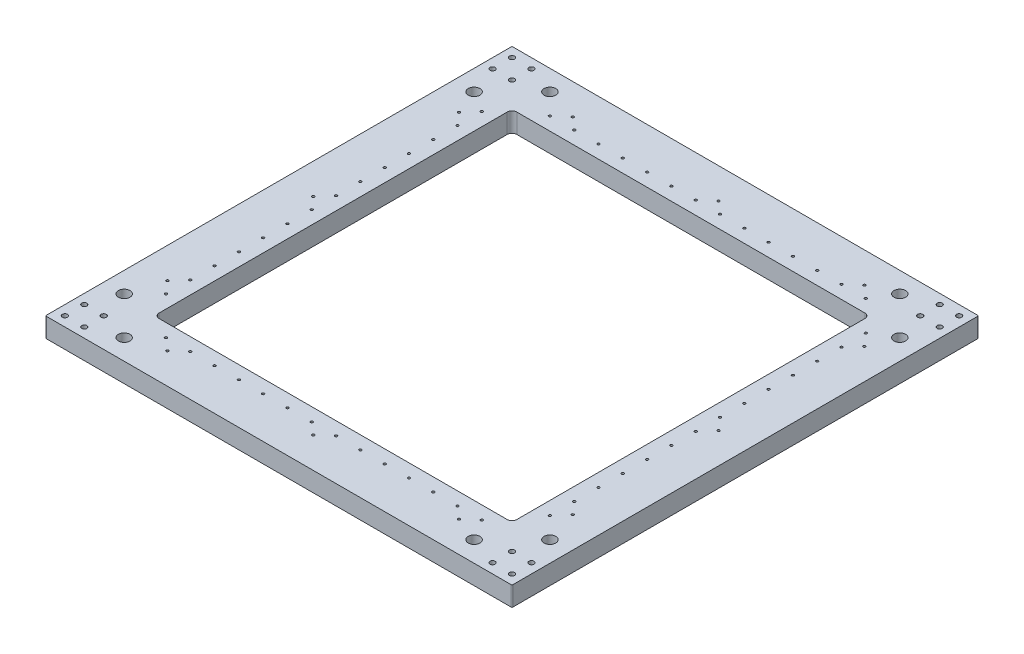
from build123d import *

# Parameters (mm, degrees)
SKETCH1_W                   = 480
SKETCH1_H                   = 480
BOSS_EXTRUDE1_DEPTH         = 20
M5_CLEARANCE_HOLE1_D        = 5.3
BEARING_PRESS_FIT_D         = 12
CIRPATTERN1_COUNT           = 4
SKETCH5_W                   = 368
SKETCH5_H                   = 368
CUT_EXTRUDE1_DEPTH          = 20
SKETCH10_W                  = 408
SKETCH10_H                  = 408
SKETCH10_W_2                = 383
SKETCH10_H_2                = 383
LINEAR_RAIL_SLOT_DEPTH      = 2.5
FILLET2_R                   = 5
FILLET1_R                   = 1
TAP_DRILL_FOR_M3X0_5_TAP1_D = 2.5
CUT_EXTRUDE2_DEPTH          = 3.5
TAP_DRILL_FOR_M3X0_5_TAP2_D = 2.5
FILLET3_R                   = 3
MIRROR7_COPY_1_D            = 2.5
MIRROR7_COPY_2_DEPTH        = 3.5
MIRROR7_COPY_3_D            = 2.5
MIRROR7_COPY_4_D            = 2.5
MIRROR7_COPY_5_DEPTH        = 3.5
MIRROR7_COPY_6_D            = 2.5


with BuildPart() as part:
    # Sketch1 → Boss-Extrude1 (new body)
    with BuildSketch(Plane(origin=(0, 0, 0), x_dir=(1, 0, 0), z_dir=(0, 1, 0))):
        Rectangle(SKETCH1_W, SKETCH1_H)
    extrude(amount=BOSS_EXTRUDE1_DEPTH)

    # M5 Clearance Hole1 (through all)
    with Locations(Plane(origin=(0, 20, 0), x_dir=(1, 0, 0), z_dir=(0, 1, 0))):
        with Locations((-230, 230), (-210, 210), (-210, 230), (-230, 210)):
            m5_clearance_hole1 = Hole(M5_CLEARANCE_HOLE1_D / 2)

    # Bearing Press Fit (through all)
    with Locations(Plane(origin=(0, 20, 0), x_dir=(1, 0, 0), z_dir=(0, 1, 0))):
        with Locations((-180, 219), (-219, 180)):
            bearing_press_fit = Hole(BEARING_PRESS_FIT_D / 2)

    # CirPattern1: M5 Clearance Hole1, Bearing Press Fit ×4 about axis
    cirpattern1_axis = Axis((0, 0, 0), (0, 1, 0))
    add([m5_clearance_hole1.rotate(cirpattern1_axis, i * 360 / CIRPATTERN1_COUNT) for i in range(1, CIRPATTERN1_COUNT)], mode=Mode.SUBTRACT)
    add([bearing_press_fit.rotate(cirpattern1_axis, i * 360 / CIRPATTERN1_COUNT) for i in range(1, CIRPATTERN1_COUNT)], mode=Mode.SUBTRACT)

    # Sketch5 → Cut-Extrude1 (cut)
    with BuildSketch(Plane(origin=(0, 20, 0), x_dir=(1, 0, 0), z_dir=(0, 1, 0))):
        Rectangle(SKETCH5_W, SKETCH5_H)
    extrude(amount=-CUT_EXTRUDE1_DEPTH, mode=Mode.SUBTRACT)

    # Sketch10 → Linear Rail Slot (cut)
    with BuildSketch(Plane(origin=(0, 0, 0), x_dir=(1, 0, 0), z_dir=(0, 1, 0))):
        Rectangle(SKETCH10_W, SKETCH10_H)
        Rectangle(SKETCH10_W_2, SKETCH10_H_2, mode=Mode.SUBTRACT)
    extrude(amount=LINEAR_RAIL_SLOT_DEPTH, mode=Mode.SUBTRACT)

    # Fillet2
    fillet2_edges = [part.edges().sort_by_distance(p)[0] for p in [
        (-184, 10, 184),
        (-184, 10, -184),
        (184, 10, -184),
        (184, 10, 184),
    ]]
    fillet(fillet2_edges, radius=FILLET2_R)

    # Fillet1
    fillet1_edges = [part.edges().sort_by_distance(p)[0] for p in [
        (-240, 10, -240),
        (240, 10, -240),
        (240, 10, 240),
        (-240, 10, 240),
    ]]
    fillet(fillet1_edges, radius=FILLET1_R)

    # Tap Drill for M3x0.5 Tap1 (through all)
    with Locations(Plane(origin=(0, 2.5, 0), x_dir=(-1, 0, 0), z_dir=(0, -1, 0))):
        with Locations((-166.5, -197.5), (-141.5, -197.5), (-116.5, -197.5), (-91.5, -197.5), (-66.5, -197.5), (-41.5, -197.5), (-16.5, -197.5), (8.5, -197.5), (33.5, -197.5), (58.5, -197.5), (83.5, -197.5), (108.5, -197.5), (133.5, -197.5), (158.5, -197.5)):
            tap_drill_for_m3x0_5_tap1 = Hole(TAP_DRILL_FOR_M3X0_5_TAP1_D / 2)

    # Sketch14 → Cut-Extrude2 (cut)
    with BuildSketch(Plane.XZ):
        with BuildLine():
            Line((-133.5, 203.5), (-158.5, 203.5))
            ThreePointArc((-158.5, 203.5), (-160.621320344, 204.378679656), (-161.5, 206.5))
            Line((-161.5, 206.5), (-161.5, 210.5))
            ThreePointArc((-161.5, 210.5), (-160.621320344, 212.621320344), (-158.5, 213.5))
            Line((-158.5, 213.5), (-133.5, 213.5))
            ThreePointArc((-133.5, 213.5), (-131.378679656, 212.621320344), (-130.5, 210.5))
            Line((-130.5, 210.5), (-130.5, 206.5))
            ThreePointArc((-130.5, 206.5), (-131.378679656, 204.378679656), (-133.5, 203.5))
        make_face()
        with BuildLine():
            Line((16.5, 203.5), (-8.5, 203.5))
            ThreePointArc((-8.5, 203.5), (-10.621320344, 204.378679656), (-11.5, 206.5))
            Line((-11.5, 206.5), (-11.5, 210.5))
            ThreePointArc((-11.5, 210.5), (-10.621320344, 212.621320344), (-8.5, 213.5))
            Line((-8.5, 213.5), (16.5, 213.5))
            ThreePointArc((16.5, 213.5), (18.621320344, 212.621320344), (19.5, 210.5))
            Line((19.5, 210.5), (19.5, 206.5))
            ThreePointArc((19.5, 206.5), (18.621320344, 204.378679656), (16.5, 203.5))
        make_face()
        with BuildLine():
            Line((166.5, 203.5), (141.5, 203.5))
            ThreePointArc((141.5, 203.5), (139.378679656, 204.378679656), (138.5, 206.5))
            Line((138.5, 206.5), (138.5, 210.5))
            ThreePointArc((138.5, 210.5), (139.378679656, 212.621320344), (141.5, 213.5))
            Line((141.5, 213.5), (166.5, 213.5))
            ThreePointArc((166.5, 213.5), (168.621320344, 212.621320344), (169.5, 210.5))
            Line((169.5, 210.5), (169.5, 206.5))
            ThreePointArc((169.5, 206.5), (168.621320344, 204.378679656), (166.5, 203.5))
        make_face()
    cut_extrude2 = extrude(amount=-CUT_EXTRUDE2_DEPTH, mode=Mode.SUBTRACT)

    # Tap Drill for M3x0.5 Tap2 (through all)
    with Locations(Plane(origin=(0, 3.5, 0), x_dir=(-1, 0, 0), z_dir=(0, -1, 0))):
        with Locations((-154, -208.5), (-4, -208.5), (146, -208.5)):
            tap_drill_for_m3x0_5_tap2 = Hole(TAP_DRILL_FOR_M3X0_5_TAP2_D / 2)

    # Fillet3
    # the kernel refuses this fillet: 3 mm, written as the material it takes off along each edge
    with BuildSketch(Plane(origin=(168.158312395, 2.5, 204), x_dir=(1, 0, 0), z_dir=(0, -1, 0)), Plane(origin=(18.158312395, 2.5, 204), x_dir=(1, 0, 0), z_dir=(0, -1, 0)), Plane(origin=(-131.841687605, 2.5, 204), x_dir=(1, 0, 0), z_dir=(0, -1, 0))) as fillet3_piece_1:
        with BuildLine():
            CenterArc((4.341687605, 3), FILLET3_R, 180, 90)
            Line((1.341687605, 3), (1.041687605, 3))
            ThreePointArc((1.041687605, 3), (1.041687605, 2.5), (-0.16583124, 0.25))
            Line((-0.16583124, 0.25), (0, -0.3))
            Line((0, -0.3), (4.341687605, -0.3))
            Line((4.341687605, -0.3), (4.341687605, 0))
        make_face()
    extrude(amount=13.354219012, mode=Mode.SUBTRACT)
    with BuildSketch(Plane(origin=(139.841687605, 2.5, 204), x_dir=(-0.40826016232850865, 0, 0.9128656198233669), z_dir=(0, -1, 0)), Plane(origin=(-10.158312395, 2.5, 204), x_dir=(-0.4082601623285113, 0, 0.9128656198233657), z_dir=(0, -1, 0)), Plane(origin=(-160.158312395, 2.5, 204), x_dir=(-0.40826016232850865, 0, 0.9128656198233669), z_dir=(0, -1, 0))) as fillet3_piece_2:
        with BuildLine():
            CenterArc((4.511134946, 2.738596859), FILLET3_R, 155.904412315, 90)
            Line((1.772538086, 3.963377346), (1.4986784, 4.085855395))
            Line((1.4986784, 4.085855395), (-0.273859686, 0.122478049))
            Line((-0.273859686, 0.122478049), (0.160514116, -0.253446678))
            ThreePointArc((0.160514116, -0.253446678), (2.7074436, -0.069729605), (3.16387641, -0.273859686))
            Line((3.16387641, -0.273859686), (3.286354459, 0))
        make_face()
    extrude(amount=13.354219012, mode=Mode.SUBTRACT)

    # Mirror3: Tap Drill for M3x0.5 Tap1, Cut-Extrude2, Tap Drill for M3x0.5 Tap2 across plane
    add(tap_drill_for_m3x0_5_tap1.mirror(Plane(origin=(0, 0, 0), x_dir=(-0.7071067811865478, 0, 0.7071067811865472), z_dir=(0.7071067811865475, 0, 0.7071067811865477))), mode=Mode.SUBTRACT)
    add(cut_extrude2.mirror(Plane(origin=(0, 0, 0), x_dir=(-0.7071067811865478, 0, 0.7071067811865472), z_dir=(0.7071067811865475, 0, 0.7071067811865477))), mode=Mode.SUBTRACT)
    add(tap_drill_for_m3x0_5_tap2.mirror(Plane(origin=(0, 0, 0), x_dir=(-0.7071067811865478, 0, 0.7071067811865472), z_dir=(0.7071067811865475, 0, 0.7071067811865477))), mode=Mode.SUBTRACT)

    # Mirror5: Tap Drill for M3x0.5 Tap1, Cut-Extrude2, Tap Drill for M3x0.5 Tap2 across plane
    add(tap_drill_for_m3x0_5_tap1.mirror(Plane.XY), mode=Mode.SUBTRACT)
    add(cut_extrude2.mirror(Plane.XY), mode=Mode.SUBTRACT)
    add(tap_drill_for_m3x0_5_tap2.mirror(Plane.XY), mode=Mode.SUBTRACT)

    # Mirror7 copy 1 (through all)
    with Locations(Plane(origin=(0, 2.5, 0), x_dir=(0, 0, 1), z_dir=(0, -1, 0))):
        with Locations((-166.5, -197.5), (-141.5, -197.5), (-116.5, -197.5), (-91.5, -197.5), (-66.5, -197.5), (-41.5, -197.5), (-16.5, -197.5), (8.5, -197.5), (33.5, -197.5), (58.5, -197.5), (83.5, -197.5), (108.5, -197.5), (133.5, -197.5), (158.5, -197.5)):
            Hole(MIRROR7_COPY_1_D / 2)

    # Mirror7 copy 2 sketch → Mirror7 copy 2 (cut)
    with BuildSketch(Plane(origin=(0, 0, 0), x_dir=(0, 0, -1), z_dir=(0, -1, 0))):
        with BuildLine():
            Line((-133.5, 203.5), (-158.5, 203.5))
            ThreePointArc((-158.5, 203.5), (-160.621320344, 204.378679656), (-161.5, 206.5))
            Line((-161.5, 206.5), (-161.5, 210.5))
            ThreePointArc((-161.5, 210.5), (-160.621320344, 212.621320344), (-158.5, 213.5))
            Line((-158.5, 213.5), (-133.5, 213.5))
            ThreePointArc((-133.5, 213.5), (-131.378679656, 212.621320344), (-130.5, 210.5))
            Line((-130.5, 210.5), (-130.5, 206.5))
            ThreePointArc((-130.5, 206.5), (-131.378679656, 204.378679656), (-133.5, 203.5))
        make_face()
        with BuildLine():
            Line((16.5, 203.5), (-8.5, 203.5))
            ThreePointArc((-8.5, 203.5), (-10.621320344, 204.378679656), (-11.5, 206.5))
            Line((-11.5, 206.5), (-11.5, 210.5))
            ThreePointArc((-11.5, 210.5), (-10.621320344, 212.621320344), (-8.5, 213.5))
            Line((-8.5, 213.5), (16.5, 213.5))
            ThreePointArc((16.5, 213.5), (18.621320344, 212.621320344), (19.5, 210.5))
            Line((19.5, 210.5), (19.5, 206.5))
            ThreePointArc((19.5, 206.5), (18.621320344, 204.378679656), (16.5, 203.5))
        make_face()
        with BuildLine():
            Line((166.5, 203.5), (141.5, 203.5))
            ThreePointArc((141.5, 203.5), (139.378679656, 204.378679656), (138.5, 206.5))
            Line((138.5, 206.5), (138.5, 210.5))
            ThreePointArc((138.5, 210.5), (139.378679656, 212.621320344), (141.5, 213.5))
            Line((141.5, 213.5), (166.5, 213.5))
            ThreePointArc((166.5, 213.5), (168.621320344, 212.621320344), (169.5, 210.5))
            Line((169.5, 210.5), (169.5, 206.5))
            ThreePointArc((169.5, 206.5), (168.621320344, 204.378679656), (166.5, 203.5))
        make_face()
    extrude(amount=-MIRROR7_COPY_2_DEPTH, mode=Mode.SUBTRACT)

    # Mirror7 copy 3 (through all)
    with Locations(Plane(origin=(0, 3.5, 0), x_dir=(0, 0, 1), z_dir=(0, -1, 0))):
        with Locations((-154, -208.5), (-4, -208.5), (146, -208.5)):
            Hole(MIRROR7_COPY_3_D / 2)

    # Mirror7 copy 4 (through all)
    with Locations(Plane(origin=(0, 2.5, 0), x_dir=(0, 0, 1), z_dir=(0, -1, 0))):
        with Locations((-166.5, 197.5), (-141.5, 197.5), (-116.5, 197.5), (-91.5, 197.5), (-66.5, 197.5), (-41.5, 197.5), (-16.5, 197.5), (8.5, 197.5), (33.5, 197.5), (58.5, 197.5), (83.5, 197.5), (108.5, 197.5), (133.5, 197.5), (158.5, 197.5)):
            Hole(MIRROR7_COPY_4_D / 2)

    # Mirror7 copy 5 sketch → Mirror7 copy 5 (cut)
    with BuildSketch(Plane(origin=(0, 0, 0), x_dir=(0, 0, -1), z_dir=(0, -1, 0))):
        with BuildLine():
            Line((-133.5, -203.5), (-158.5, -203.5))
            ThreePointArc((-158.5, -203.5), (-160.621320344, -204.378679656), (-161.5, -206.5))
            Line((-161.5, -206.5), (-161.5, -210.5))
            ThreePointArc((-161.5, -210.5), (-160.621320344, -212.621320344), (-158.5, -213.5))
            Line((-158.5, -213.5), (-133.5, -213.5))
            ThreePointArc((-133.5, -213.5), (-131.378679656, -212.621320344), (-130.5, -210.5))
            Line((-130.5, -210.5), (-130.5, -206.5))
            ThreePointArc((-130.5, -206.5), (-131.378679656, -204.378679656), (-133.5, -203.5))
        make_face()
        with BuildLine():
            Line((16.5, -203.5), (-8.5, -203.5))
            ThreePointArc((-8.5, -203.5), (-10.621320344, -204.378679656), (-11.5, -206.5))
            Line((-11.5, -206.5), (-11.5, -210.5))
            ThreePointArc((-11.5, -210.5), (-10.621320344, -212.621320344), (-8.5, -213.5))
            Line((-8.5, -213.5), (16.5, -213.5))
            ThreePointArc((16.5, -213.5), (18.621320344, -212.621320344), (19.5, -210.5))
            Line((19.5, -210.5), (19.5, -206.5))
            ThreePointArc((19.5, -206.5), (18.621320344, -204.378679656), (16.5, -203.5))
        make_face()
        with BuildLine():
            Line((166.5, -203.5), (141.5, -203.5))
            ThreePointArc((141.5, -203.5), (139.378679656, -204.378679656), (138.5, -206.5))
            Line((138.5, -206.5), (138.5, -210.5))
            ThreePointArc((138.5, -210.5), (139.378679656, -212.621320344), (141.5, -213.5))
            Line((141.5, -213.5), (166.5, -213.5))
            ThreePointArc((166.5, -213.5), (168.621320344, -212.621320344), (169.5, -210.5))
            Line((169.5, -210.5), (169.5, -206.5))
            ThreePointArc((169.5, -206.5), (168.621320344, -204.378679656), (166.5, -203.5))
        make_face()
    extrude(amount=-MIRROR7_COPY_5_DEPTH, mode=Mode.SUBTRACT)

    # Mirror7 copy 6 (through all)
    with Locations(Plane(origin=(0, 3.5, 0), x_dir=(0, 0, 1), z_dir=(0, -1, 0))):
        with Locations((-154, 208.5), (-4, 208.5), (146, 208.5)):
            Hole(MIRROR7_COPY_6_D / 2)


solid = part.part
